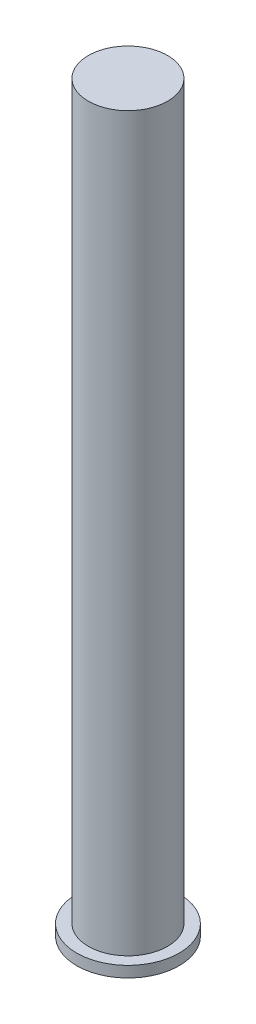
from build123d import *


with BuildPart() as part:
    # Sketch2 → Revolve1 (revolve)
    with BuildSketch(Plane.YZ):
        with BuildLine():
            Line((-104.14, 0), (0, 0))
            Line((0, 0), (0, 5.499999922))
            Line((0, 5.499999922), (-101.6, 5.499999922))
            Line((-101.6, 5.499999922), (-101.6, 7.112))
            Line((-101.6, 7.112), (-103.124, 7.112))
            ThreePointArc((-103.124, 7.112), (-103.884717139, 3.592102448), (-104.14, 0))
        make_face()
    revolve(axis=Axis((0, 0, 0), (0, -1, 0)))


solid = part.part
